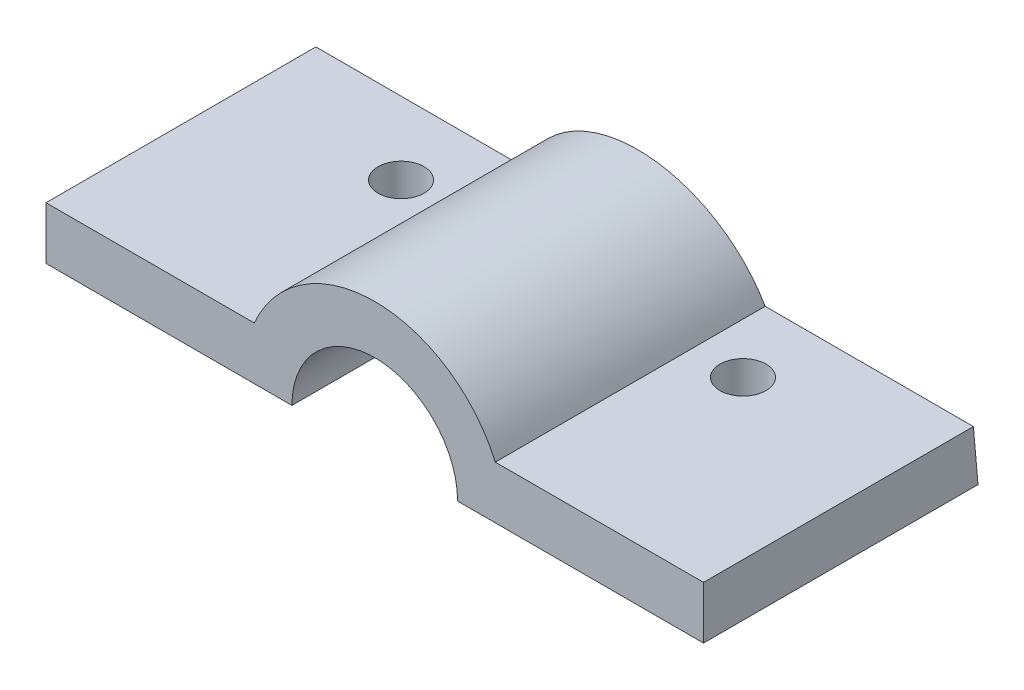
from build123d import *

# Parameters (mm, degrees)
BOSS_EXTRUDE2_DEPTH    = 26.50744
CUT_EXTRUDE1_START     = -0.02543021
CUT_EXTRUDE1_OUTLINE_W = 66
CUT_EXTRUDE1_OUTLINE_H = 16
CUT_EXTRUDE1_DEPTH     = 1.106877933
CUT_EXTRUDE2_REACH     = 45.41
SKETCH4_R              = 2.2225


# Read off the part's stored shape, not the designer's step: Cut-Extrude1
with BuildPart() as part:
    # Sketch2 → Boss-Extrude2 (new body)
    with BuildSketch(Plane.XY):
        with BuildLine():
            ThreePointArc((-11.445222977, 4.788221067), (-12.237590886, 2.302953542), (-12.505480711, -0.291778933))
            Line((-12.505480711, -0.291778933), (-7.805480711, -0.291778933))
            ThreePointArc((-7.805480711, -0.291778933), (0.194519289, 7.708221067), (8.194519289, -0.291778933))
            Line((8.194519289, -0.291778933), (12.894519289, -0.291778933))
            ThreePointArc((12.894519289, -0.291778933), (12.626629463, 2.302953542), (11.834261554, 4.788221067))
            ThreePointArc((11.834261554, 4.788221067), (0.194519289, 12.408221067), (-11.445222977, 4.788221067))
        make_face()
        with BuildLine():
            Line((-31.555480711, -0.291778933), (-12.505480711, -0.291778933))
            ThreePointArc((-12.505480711, -0.291778933), (-12.237590886, 2.302953542), (-11.445222977, 4.788221067))
            Line((-11.445222977, 4.788221067), (-31.555480711, 4.788221067))
            Line((-31.555480711, 4.788221067), (-31.555480711, -0.291778933))
        make_face()
        with BuildLine():
            ThreePointArc((11.834261554, 4.788221067), (12.626629463, 2.302953542), (12.894519289, -0.291778933))
            Line((12.894519289, -0.291778933), (31.944519289, -0.291778933))
            Line((31.944519289, -0.291778933), (31.944519289, 4.788221067))
            Line((31.944519289, 4.788221067), (11.834261554, 4.788221067))
        make_face()
    extrude(amount=BOSS_EXTRUDE2_DEPTH)

    # Cut-Extrude1 outline → Cut-Extrude1 (cut)
    with BuildSketch(Plane(origin=(0, 0, 0), x_dir=(1, 0, 0), z_dir=(0, 0.08715574274765836, -0.9961946980917455)).offset(CUT_EXTRUDE1_START)):
        with Locations((0, -6)):
            Rectangle(CUT_EXTRUDE1_OUTLINE_W, CUT_EXTRUDE1_OUTLINE_H)
    extrude(amount=CUT_EXTRUDE1_DEPTH, mode=Mode.SUBTRACT)

    # Sketch4 → Cut-Extrude2 (cut, up to next)
    with BuildSketch(Plane.XZ.offset(0.291778933), mode=Mode.PRIVATE) as cut_extrude2_sk1:
        with Locations(Location((-16.315480711, 7.45744, 0), (0, 0, 270))):
            Circle(SKETCH4_R)
    cut_extrude2_tool1 = extrude(cut_extrude2_sk1.sketch, amount=-CUT_EXTRUDE2_REACH, mode=Mode.PRIVATE) & part.part
    # Sketch4 → Cut-Extrude2 (cut, up to next)
    with BuildSketch(Plane.XZ.offset(0.291778933), mode=Mode.PRIVATE) as cut_extrude2_sk2:
        with Locations(Location((16.704519289, 7.45744, 0), (0, 0, 270))):
            Circle(SKETCH4_R)
    cut_extrude2_tool2 = extrude(cut_extrude2_sk2.sketch, amount=-CUT_EXTRUDE2_REACH, mode=Mode.PRIVATE) & part.part
    add(cut_extrude2_tool1.solids().sort_by_distance((-16.315481, -0.291779, 7.45744))[0], mode=Mode.SUBTRACT)
    add(cut_extrude2_tool2.solids().sort_by_distance((16.704519, -0.291779, 7.45744))[0], mode=Mode.SUBTRACT)


solid = part.part
